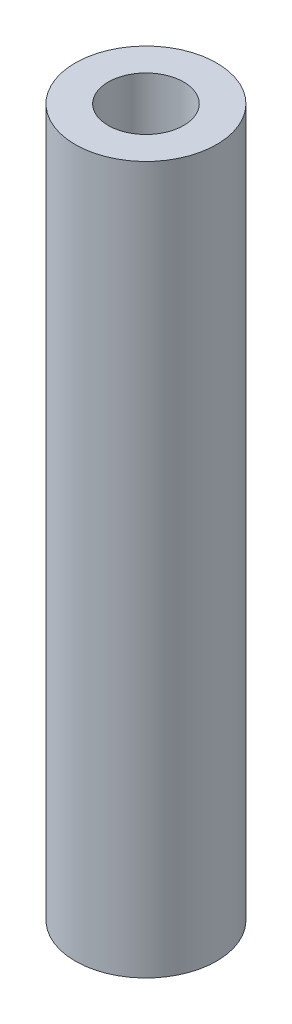
from build123d import *

# Parameters (mm, degrees)
SKETCH1_R            = 3
BOSS_EXTRUDE1_DEPTH  = 30
M3_CLEARANCE_HOLE1_D = 3.2


with BuildPart() as part:
    # Sketch1 → Boss-Extrude1 (new body)
    with BuildSketch(Plane(origin=(0, 0, 0), x_dir=(1, 0, 0), z_dir=(0, 1, 0))):
        Circle(SKETCH1_R)
    extrude(amount=BOSS_EXTRUDE1_DEPTH)

    # M3 Clearance Hole1 (through all)
    with Locations(Plane(origin=(0, 30, 0), x_dir=(1, 0, 0), z_dir=(0, 1, 0))):
        with Locations((0, 0)):
            Hole(M3_CLEARANCE_HOLE1_D / 2)


solid = part.part
